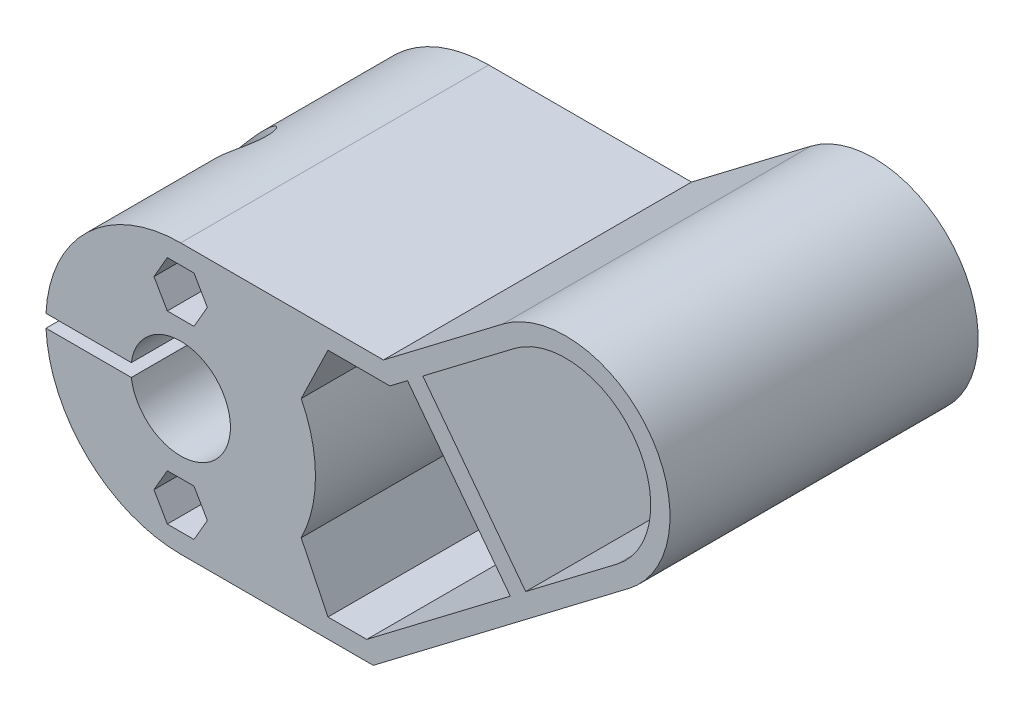
from build123d import *
from build123d.topology import SkipClean

# Parameters (mm, degrees)
BOSS_EXTRUDE1_DEPTH     = 5
BOSS_EXTRUDE2_DEPTH     = 43
CUT_EXTRUDE1_DEPTH      = 99.344878968
CUT_EXTRUDE1_DEPTH_BACK = 99.344878968
SKETCH4_R               = 2.25
CUT_EXTRUDE2_DEPTH      = 14
SKETCH6_R               = 3.75
CUT_EXTRUDE3_DEPTH      = 14
SKETCH7_R               = 2.25
CUT_EXTRUDE4_DEPTH      = 50
CUT_EXTRUDE5_DEPTH      = 28
EXTRUDE_THIN1_DEPTH     = 43
CHAMFER1_SIZE           = 5
CHAMFER2_START          = 4.9999999
CHAMFER2_DEPTH          = 43.0000001
CHAMFER3_SIZE           = 10
CHAMFER3_SIZE_2         = 7.855445392
EXTRUDE_THIN2_REACH     = 99.948


with BuildPart() as part:
    # Sketch1 → Boss-Extrude1 (new body)
    with BuildSketch(Plane.XY):
        with BuildLine():
            Line((0, 21), (31.588461174, 21))
            Line((31.588461174, 21), (50.172213659, 35.135394674))
            ThreePointArc((50.172213659, 35.135394674), (72.920555239, 32.042625706), (69.827786272, 9.294284126))
            Line((69.827786272, 9.294284126), (30, -21))
            Line((30, -21), (0, -21))
            ThreePointArc((0, -21), (-14.491376746, -15.198684154), (-20.976176963, -1))
            Line((-20.976176963, -1), (-7.685213074, -1))
            ThreePointArc((-7.685213074, -1), (7.75, 0), (-7.685213074, 1))
            Line((-7.685213074, 1), (-20.976176963, 1))
            ThreePointArc((-20.976176963, 1), (-14.491376746, 15.198684154), (0, 21))
        make_face()
        with BuildLine():
            Line((27.437787439, 0.273900145), (29.82554698, 2.090106184))
            ThreePointArc((29.82554698, 2.090106184), (32.978521164, 1.661441058), (32.549856038, -1.491533127))
            Line((32.549856038, -1.491533127), (30.162096497, -3.307739166))
            ThreePointArc((30.162096497, -3.307739166), (27.009122313, -2.87907404), (27.437787439, 0.273900145))
        make_face(mode=Mode.SUBTRACT)
        with BuildLine():
            Line((62.556034265, 21.332122764), (60.168274724, 19.515916725))
            ThreePointArc((60.168274724, 19.515916725), (57.01530054, 19.944581851), (57.443965666, 23.097556036))
            Line((57.443965666, 23.097556036), (59.831725206, 24.913762075))
            ThreePointArc((59.831725206, 24.913762075), (62.984699391, 24.485096949), (62.556034265, 21.332122764))
        make_face(mode=Mode.SUBTRACT)
    extrude(amount=BOSS_EXTRUDE1_DEPTH)

    # Sketch2 → Boss-Extrude2 (add)
    with SkipClean():  # the faces are left unmerged after this step: merging them gives an invalid solid
        with BuildSketch(Plane.XY.offset(5)):
            with BuildLine():
                Line((-7.685213074, -1), (-20.976176963, -1))
                ThreePointArc((-20.976176963, -1), (-14.491376746, -15.198684154), (0, -21))
                ThreePointArc((0, -21), (21, 0), (0, 21))
                ThreePointArc((0, 21), (-14.491376746, 15.198684154), (-20.976176963, 1))
                Line((-20.976176963, 1), (-7.685213074, 1))
                ThreePointArc((-7.685213074, 1), (7.75, 0), (-7.685213074, -1))
            make_face()
        extrude(amount=BOSS_EXTRUDE2_DEPTH)
    add(part.part.scale(1), mode=Mode.REPLACE)  # the faces are merged on a copy

    # Sketch4 → Cut-Extrude1 (cut, two sides: drawn at the far end of the back side and taken through both)
    with SkipClean():  # the faces are left unmerged after this step: merging them gives an invalid solid
        with BuildSketch(Plane(origin=(0, -1, 0), x_dir=(1, 0, 0), z_dir=(0, 1, 0)).offset(-CUT_EXTRUDE1_DEPTH_BACK)):
            with Locations(Location((-14.330695019, -24, 0), (0, 0, 180))):
                Circle(SKETCH4_R)
        extrude(amount=CUT_EXTRUDE1_DEPTH + CUT_EXTRUDE1_DEPTH_BACK, mode=Mode.SUBTRACT)

    # Sketch5 → Cut-Extrude2 (cut)
    with SkipClean():  # the faces are left unmerged after this step: merging them gives an invalid solid
        with BuildSketch(Plane.XZ.offset(21)):
            Polygon((-12.834085604, 19.936730349), (-10.063495571, 23.264466947), (-11.560104986, 27.327736598), (-15.827304434, 28.063269651), (-18.597894467, 24.735533053), (-17.101285052, 20.672263402), align=None)
        extrude(amount=-CUT_EXTRUDE2_DEPTH, mode=Mode.SUBTRACT)

    # Sketch6 → Cut-Extrude3 (cut)
    with SkipClean():  # the faces are left unmerged after this step: merging them gives an invalid solid
        with BuildSketch(Plane(origin=(0, 21, 0), x_dir=(1, 0, 0), z_dir=(0, 1, 0))):
            with Locations(Location((-14.330695019, -24, 0), (0, 0, 270))):
                Circle(SKETCH6_R)
        extrude(amount=-CUT_EXTRUDE3_DEPTH, mode=Mode.SUBTRACT)

    # Sketch7 → Cut-Extrude4 (cut)
    with SkipClean():  # the faces are left unmerged after this step: merging them gives an invalid solid
        with BuildSketch(Plane(origin=(0, 0, 0), x_dir=(-1, 0, 0), z_dir=(0, 0, -1))):
            with Locations((0, 14.375)):
                Circle(SKETCH7_R)
            with Locations((0, -14.375)):
                Circle(SKETCH7_R)
        extrude(amount=-CUT_EXTRUDE4_DEPTH, mode=Mode.SUBTRACT)

    # Sketch8 → Cut-Extrude5 (cut)
    with SkipClean():  # the faces are left unmerged after this step: merging them gives an invalid solid
        with BuildSketch(Plane.XY.offset(48)):
            Polygon((4.156921938, 14.375), (2.078460969, 17.975), (-2.078460969, 17.975), (-4.156921938, 14.375), (-2.078460969, 10.775), (2.078460969, 10.775), align=None)
            Polygon((4.156921938, -14.375), (2.078460969, -10.775), (-2.078460969, -10.775), (-4.156921938, -14.375), (-2.078460969, -17.975), (2.078460969, -17.975), align=None)
        extrude(amount=-CUT_EXTRUDE5_DEPTH, mode=Mode.SUBTRACT)

    # Sketch9 → Extrude-Thin1 (add)
    with SkipClean():  # the faces are left unmerged after this step: merging them gives an invalid solid
        with BuildSketch(Plane.XY.offset(5)):
            with BuildLine():
                Line((0, 21), (31.588461174, 21))
                Line((31.588461174, 21), (50.172213659, 35.135394674))
                ThreePointArc((50.172213659, 35.135394674), (72.920555239, 32.042625706), (69.827786272, 9.294284126))
                Line((69.827786272, 9.294284126), (30, -21))
                Line((30, -21), (0, -21))
                Line((0, -21), (0, -18))
                Line((0, -18), (28.988704289, -18))
                Line((28.988704289, -18), (68.011580233, 11.682043667))
                ThreePointArc((68.011580233, 11.682043667), (70.532795698, 30.226419667), (51.988419698, 32.747635133))
                Line((51.988419698, 32.747635133), (32.599756885, 18))
                Line((32.599756885, 18), (0, 18))
                Line((0, 18), (0, 21))
            make_face()
        extrude(amount=EXTRUDE_THIN1_DEPTH)

    # Chamfer1
    chamfer1_edges = [part.edges().sort_by_distance(p)[0] for p in [
        (21, 0, 5),
        (19.902679058, -18, 5),
        (21.708205356, 18, 5),
        (42.294088292, 25.373817566, 5),
        (70.532795698, 30.226419667, 5),
        (48.500142261, -3.158978166, 5),
    ]]
    chamfer(chamfer1_edges, length=CHAMFER1_SIZE)

    # Chamfer2: read off the stored shape, not the designer's step
    # Chamfer2 outline → Chamfer2 (add)
    with SkipClean():  # the faces are left unmerged after this step: merging them gives an invalid solid
        with BuildSketch(Plane.XY.offset(CHAMFER2_START)):
            with BuildLine():
                Line((10.816653826, -18), (15.091675551, -18))
                Line((15.091675551, -18), (17.124404275, -12.155442329))
                ThreePointArc((17.124404275, -12.155442329), (14.272890231, -15.404045068), (10.816653826, -18))
            make_face()
            with BuildLine():
                ThreePointArc((10.816653826, 18), (14.272890231, 15.404045068), (17.124404275, 12.155442329))
                Line((17.124404275, 12.155442329), (15.091675551, 18))
                Line((15.091675551, 18), (10.816653826, 18))
            make_face()
        extrude(amount=CHAMFER2_DEPTH)

    # Chamfer3
    # the kernel refuses this chamfer: 10, 7.855445392 mm, written as the material it adds along each edge
    with BuildSketch(Plane(origin=(15.091675551, -18, -15.71682988), x_dir=(0.32849742893027223, 0.9445048645646038, 0), z_dir=(0, 0, 1))) as chamfer3_piece_1_section:
        Polygon((CHAMFER3_SIZE, 0), (CHAMFER3_SIZE_2 * 0.328497428916, -CHAMFER3_SIZE_2 * 0.944504864523), (0, 0), align=None)
    chamfer3_piece_1 = extrude(amount=63.71682988, mode=Mode.PRIVATE)
    chamfer3_piece_1 = split(chamfer3_piece_1, bisect_by=Plane(origin=(15.091675551, -5.14158506, -2.85841494), z_dir=(0, 0.7071067811865476, 0.7071067811865476)), keep=Keep.TOP, mode=Mode.PRIVATE)
    add(chamfer3_piece_1)
    with BuildSketch(Plane(origin=(15.091675551, 18, -15.71682988), x_dir=(0.32849742893027223, -0.9445048645646039, 0), z_dir=(0, 0, 1))) as chamfer3_piece_2_section:
        Polygon((CHAMFER3_SIZE, 0), (CHAMFER3_SIZE_2 * 0.328497428916, CHAMFER3_SIZE_2 * 0.944504864523), (0, 0), align=None)
    chamfer3_piece_2 = extrude(amount=63.71682988, mode=Mode.PRIVATE)
    chamfer3_piece_2 = split(chamfer3_piece_2, bisect_by=Plane(origin=(15.091675551, 5.14158506, -2.85841494), z_dir=(0, -0.7071067811865476, 0.7071067811865476)), keep=Keep.TOP, mode=Mode.PRIVATE)
    add(chamfer3_piece_2)

    # Extrude-Thin2: up to this face of the body (flat: up to its plane)
    extrude_thin2_end = Plane(part.part.faces().sort_by_distance((44.470080552, 10.533508587, 5))[0])
    # Sketch10 → Extrude-Thin2 (add, up to the picked face)
    with BuildSketch(Plane.XY.offset(48), mode=Mode.PRIVATE) as extrude_thin2_sk1:
        Polygon((33.519574493, 22.468866363), (53.175147106, -3.372244184), (55.562906646, -1.556038145), (35.907334034, 24.285072402), align=None)
    extrude_thin2_tool1 = split(extrude(extrude_thin2_sk1.sketch, amount=-EXTRUDE_THIN2_REACH, mode=Mode.PRIVATE), bisect_by=extrude_thin2_end, keep=Keep.BOTH, mode=Mode.PRIVATE)
    add(extrude_thin2_tool1.solids().sort_by(Axis((44.541241, 10.456414, 48), (0, 0, -1)))[0])


solid = part.part
